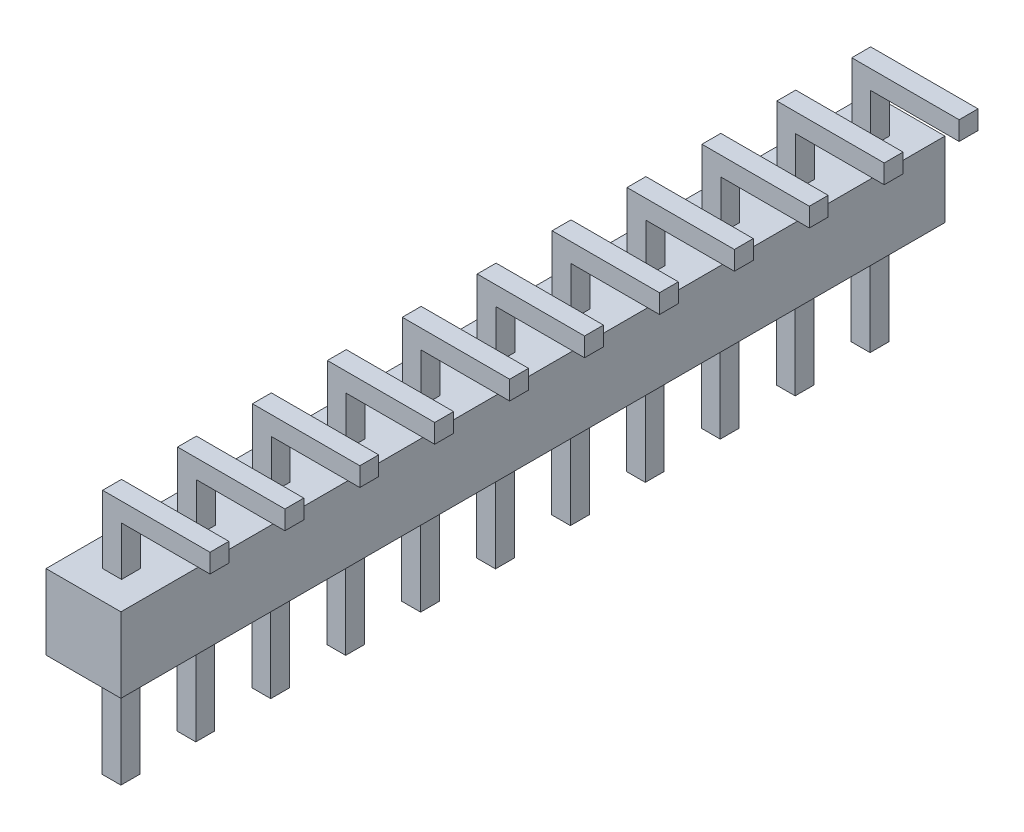
from build123d import *

# Parameters (mm, degrees)
SKETCH1_W           = 2.54
SKETCH1_H           = 2.54
BOSS_EXTRUDE1_DEPTH = 27.94
SKETCH2_W           = 0.64
SKETCH2_H           = 0.64
BOSS_EXTRUDE2_DEPTH = 3.5
LPATTERN1_COUNT     = 11
LPATTERN1_PITCH     = 2.54
SKETCH3_W           = 0.64
SKETCH3_H           = 0.64
BOSS_EXTRUDE3_DEPTH = 2.3
LPATTERN2_COUNT     = 11
LPATTERN2_PITCH     = 2.54
SKETCH4_W           = 0.64
SKETCH4_H           = 0.64
BOSS_EXTRUDE4_DEPTH = 3
LPATTERN3_COUNT     = 11
LPATTERN3_PITCH     = 2.54


with BuildPart() as part:
    # Sketch1 → Boss-Extrude1 (new body)
    with BuildSketch(Plane.XY):
        with Locations((1.27, 1.27)):
            Rectangle(SKETCH1_W, SKETCH1_H)
    extrude(amount=BOSS_EXTRUDE1_DEPTH)

    # Sketch2 → Boss-Extrude2 (add)
    with BuildSketch(Plane.XZ):
        with Locations((1.27, 26.67)):
            Rectangle(SKETCH2_W, SKETCH2_H)
    boss_extrude2 = extrude(amount=BOSS_EXTRUDE2_DEPTH)

    # LPattern1: Boss-Extrude2 ×11
    with Locations(*[(0, 0, -i * LPATTERN1_PITCH) for i in range(1, LPATTERN1_COUNT)]):
        add(boss_extrude2)

    # Sketch3 → Boss-Extrude3 (add)
    with BuildSketch(Plane(origin=(0, 2.54, 0), x_dir=(1, 0, 0), z_dir=(0, 1, 0))):
        with Locations((1.28, -1.26)):
            Rectangle(SKETCH3_W, SKETCH3_H)
    boss_extrude3 = extrude(amount=BOSS_EXTRUDE3_DEPTH)

    # LPattern2: Boss-Extrude3 ×11
    with Locations(*[(0, 0, i * LPATTERN2_PITCH) for i in range(1, LPATTERN2_COUNT)]):
        add(boss_extrude3)

    # Sketch4 → Boss-Extrude4 (add)
    with BuildSketch(Plane(origin=(1.6, 0, 0), x_dir=(0, 0, -1), z_dir=(1, 0, 0))):
        with Locations((-1.26, 4.52)):
            Rectangle(SKETCH4_W, SKETCH4_H)
    boss_extrude4 = extrude(amount=BOSS_EXTRUDE4_DEPTH)

    # LPattern3: Boss-Extrude4 ×11
    with Locations(*[(0, 0, i * LPATTERN3_PITCH) for i in range(1, LPATTERN3_COUNT)]):
        add(boss_extrude4)


solid = part.part
